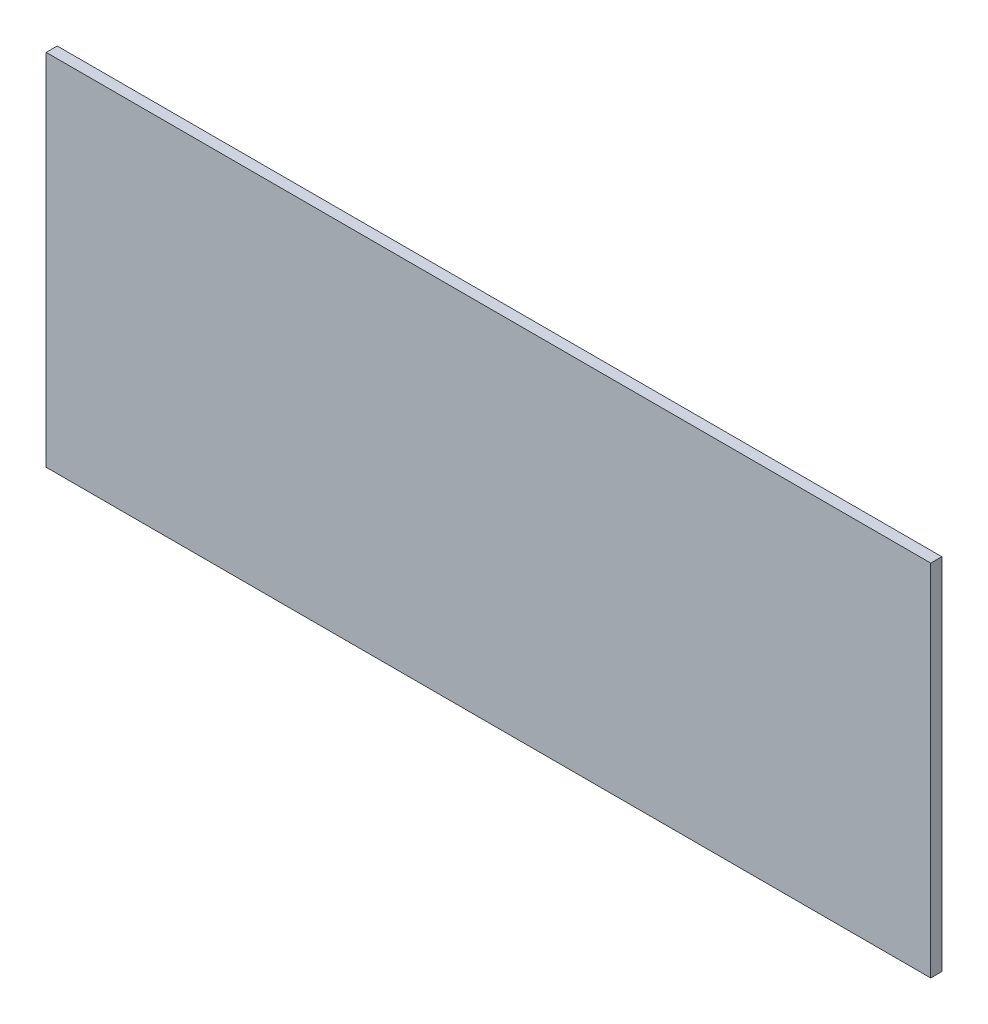
from build123d import *

# Parameters (mm, degrees)
CROQUIS1_W              = 160
CROQUIS1_H              = 65
SALIENTE_EXTRUIR1_DEPTH = 2


with BuildPart() as part:
    # Croquis1 → Saliente-Extruir1 (new body)
    with BuildSketch(Plane.XY):
        Rectangle(CROQUIS1_W, CROQUIS1_H)
    extrude(amount=SALIENTE_EXTRUIR1_DEPTH)


solid = part.part
